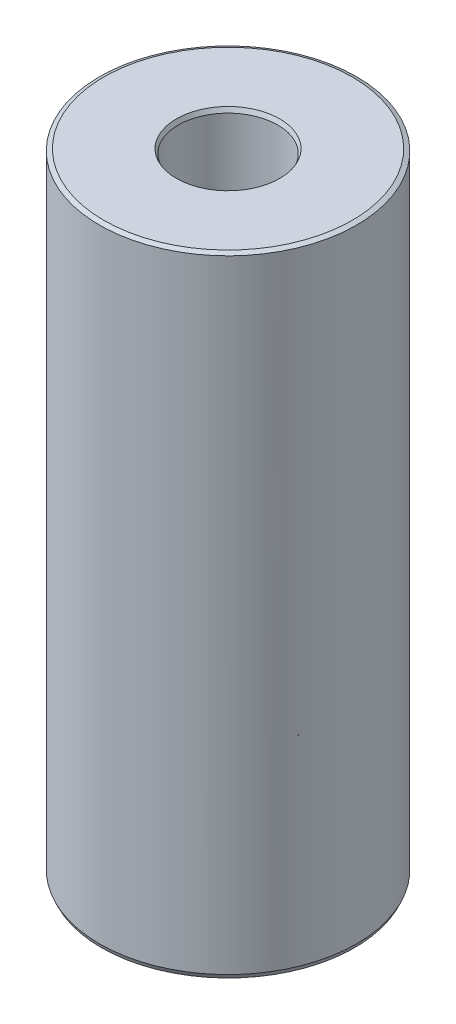
from build123d import *
from OCP.BRepFilletAPI import BRepFilletAPI_MakeChamfer

# Parameters (mm, degrees)
SKETCH1_R           = 57.5
BOSS_EXTRUDE1_DEPTH = 281.227169678
SKETCH2_R           = 22.229303778
CUT_EXTRUDE1_DEPTH  = 293.747708727
CHAMFER1_SIZE       = 0.875113182
CHAMFER1_SIZE2      = 1.945245661


with BuildPart() as part:
    # Sketch1 → Boss-Extrude1 (new body)
    with BuildSketch(Plane(origin=(0, 0, 0), x_dir=(1, 0, 0), z_dir=(0, 1, 0))):
        Circle(SKETCH1_R)
    extrude(amount=BOSS_EXTRUDE1_DEPTH)

    # Sketch2 → Cut-Extrude1 (cut, through all)
    with BuildSketch(Plane(origin=(0, 0, 0), x_dir=(1, 0, 0), z_dir=(0, 1, 0))):
        Circle(SKETCH2_R)
    extrude(amount=CUT_EXTRUDE1_DEPTH, mode=Mode.SUBTRACT)

    # Chamfer1: one chamfer whose edges measure the first distance from different faces: ONE call of the kernel's chamfer builder (chamfer() names one face for all edges)
    chamfer1_edges_1 = [part.edges().sort_by_distance(p)[0] for p in [
        (-22.229303778, 281.227169678, 0),
    ]]
    chamfer1_side_1 = [part.faces().sort_by_distance(p)[0] for p in [
        (-55.873654403, 281.227169678, 0),
    ]]
    chamfer1_edges_2 = [part.edges().sort_by_distance(p)[0] for p in [
        (-22.229303778, 0, 0),
    ]]
    chamfer1_side_2 = [part.faces().sort_by_distance(p)[0] for p in [
        (-22.229303778, 140.613584839, 0),
    ]]
    chamfer1_edges_3 = [part.edges().sort_by_distance(p)[0] for p in [
        (-57.5, 0, 0),
    ]]
    chamfer1_side_3 = [part.faces().sort_by_distance(p)[0] for p in [
        (-55.873654403, 0, 0),
    ]]
    chamfer1_edges_4 = [part.edges().sort_by_distance(p)[0] for p in [
        (-57.5, 281.227169678, 0),
    ]]
    chamfer1_side_4 = [part.faces().sort_by_distance(p)[0] for p in [
        (-57.5, 140.613584839, 0),
    ]]
    chamfer1 = BRepFilletAPI_MakeChamfer(part.part.solid().wrapped)
    for e in chamfer1_edges_1:
        chamfer1.Add(CHAMFER1_SIZE, CHAMFER1_SIZE2, e.wrapped, chamfer1_side_1[0].wrapped)  # the first distance lies on this face
    for e in chamfer1_edges_2:
        chamfer1.Add(CHAMFER1_SIZE, CHAMFER1_SIZE2, e.wrapped, chamfer1_side_2[0].wrapped)  # the first distance lies on this face
    for e in chamfer1_edges_3:
        chamfer1.Add(CHAMFER1_SIZE, CHAMFER1_SIZE2, e.wrapped, chamfer1_side_3[0].wrapped)  # the first distance lies on this face
    for e in chamfer1_edges_4:
        chamfer1.Add(CHAMFER1_SIZE, CHAMFER1_SIZE2, e.wrapped, chamfer1_side_4[0].wrapped)  # the first distance lies on this face
    add(Compound.cast(chamfer1.Shape()), mode=Mode.REPLACE)


solid = part.part
